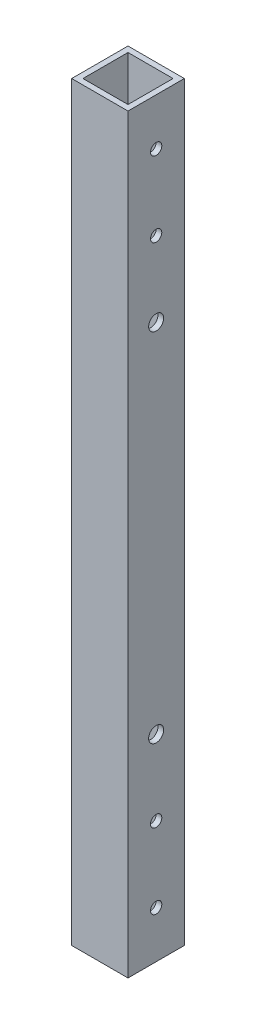
from build123d import *

# Parameters (mm, degrees)
SKETCH_1_W                = 15
SKETCH_1_H                = 15
SKETCH_1_W_2              = 12
SKETCH_1_H_2              = 12
EXTRUDE_1_DEPTH           = 200
CUT_EXTRUDE_START         = -7.5
CUT_EXTRUDE_1_OUTLINE_R   = 1.5
CUT_EXTRUDE_1_OUTLINE_R_2 = 2
CUT_EXTRUDE_1_DEPTH       = 15


# Read off the part's stored shape, not the designer's step: 切除-拉伸1
with BuildPart() as part:
    # 草图1 → 凸台-拉伸1 (new body)
    with BuildSketch(Plane(origin=(0, 0, 0), x_dir=(1, 0, 0), z_dir=(0, 1, 0))):
        Rectangle(SKETCH_1_W, SKETCH_1_H)
        Rectangle(SKETCH_1_W_2, SKETCH_1_H_2, mode=Mode.SUBTRACT)
    extrude(amount=EXTRUDE_1_DEPTH)

    # 切除-拉伸1 outline → 切除-拉伸1 (cut)
    with BuildSketch(Plane.YZ.offset(CUT_EXTRUDE_START)):
        with Locations((12.5, 0)):
            Circle(CUT_EXTRUDE_1_OUTLINE_R)
        with Locations((32.5, 0)):
            Circle(CUT_EXTRUDE_1_OUTLINE_R)
        with Locations((52.5, 0)):
            Circle(CUT_EXTRUDE_1_OUTLINE_R_2)
        with Locations((147.5, 0)):
            Circle(CUT_EXTRUDE_1_OUTLINE_R_2)
        with Locations((167.5, 0)):
            Circle(CUT_EXTRUDE_1_OUTLINE_R)
        with Locations((187.5, 0)):
            Circle(CUT_EXTRUDE_1_OUTLINE_R)
    extrude(amount=CUT_EXTRUDE_1_DEPTH, mode=Mode.SUBTRACT)


solid = part.part
